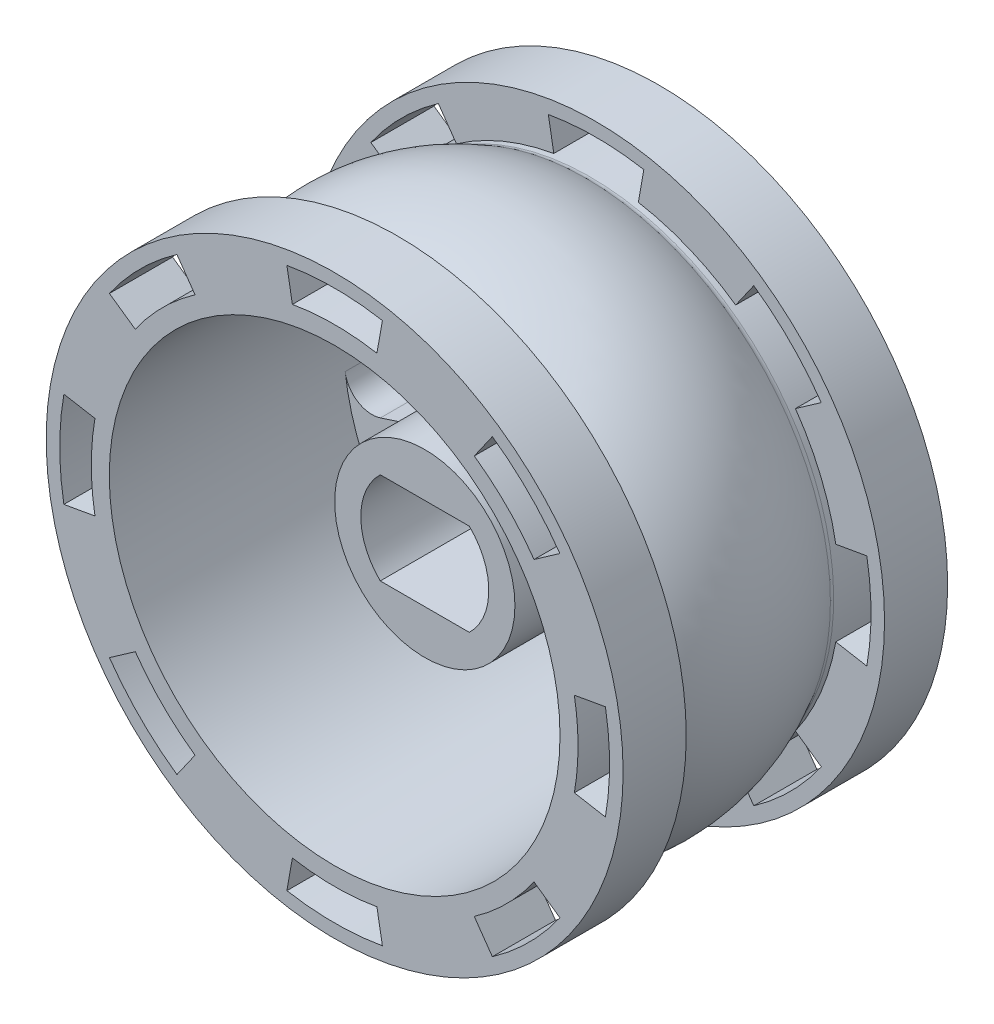
from build123d import *
from build123d.topology import SkipClean

# Parameters (mm, degrees)
SKETCH_1_R                      = 16
EXTRUDE_1_DEPTH                 = 9
SKETCH_2_R                      = 12.5
CUT_EXTRUDE_1_DEPTH             = 13
CUT_EXTRUDE_2_DEPTH             = 10
PATTERN_CIRCULAR_1_COUNT        = 3
EXTRUDE_START                   = 8
SKETCH_4_R                      = 5
EXTRUDE_2_DEPTH                 = 8
CUT_EXTRUDE_3_DEPTH             = 16
SKETCH_6_R                      = 1.275
CUT_EXTRUDE_4_DEPTH             = 10
PATTERN_CIRCULAR_2_COUNT        = 3
SKETCH_7_R                      = 20
SKETCH_7_R_2                    = 13.5
CUT_EXTRUDE_5_DEPTH             = 5.5
CUT_EXTRUDE_START               = -5
CUT_EXTRUDE_6_DEPTH             = 5
PATTERN_CIRCULAR_3_COUNT        = 8
PATTERN_START                   = -5
PATTERN_CIRCULAR_3_COPY_1_DEPTH = 5
PATTERN_CIRCULAR_3_COPY_2_DEPTH = 5
PATTERN_CIRCULAR_3_COPY_3_DEPTH = 5
PATTERN_CIRCULAR_3_COPY_4_DEPTH = 5
PATTERN_CIRCULAR_3_COPY_5_DEPTH = 5
PATTERN_CIRCULAR_3_COPY_6_DEPTH = 5
PATTERN_CIRCULAR_3_COPY_7_DEPTH = 5
FILLET_1_R                      = 1.5
FILLET_2_R                      = 0.5


with BuildPart() as part:
    # 草图1 → 凸台-拉伸1 (new, symmetric)
    with BuildSketch(Plane.XY):
        Circle(SKETCH_1_R)
    extrude(amount=EXTRUDE_1_DEPTH, both=True)

    # 草图2 → 切除-拉伸1 (cut)
    with BuildSketch(Plane.XY.offset(9)):
        Circle(SKETCH_2_R)
    extrude(amount=-CUT_EXTRUDE_1_DEPTH, mode=Mode.SUBTRACT)

    # 草图3 → 切除-拉伸2 (cut)
    with BuildSketch(Plane.XY.offset(-4)):
        with BuildLine():
            ThreePointArc((3.25, -3.799671038), (1.732288199, -4.69032809), (0, -5))
            Line((0, -5), (0, -12.5))
            ThreePointArc((0, -12.5), (4.785933382, -11.547503698), (8.842493348, -8.835174667))
            Line((8.842493348, -8.835174667), (3.25, -3.799671038))
        make_face()
        with BuildLine():
            ThreePointArc((0, -5), (-1.732288199, -4.69032809), (-3.25, -3.799671038))
            Line((-3.25, -3.799671038), (-8.842493348, -8.835174667))
            ThreePointArc((-8.842493348, -8.835174667), (-4.785933382, -11.547503698), (0, -12.5))
            Line((0, -12.5), (0, -5))
        make_face()
    cut_extrude_2 = extrude(amount=-CUT_EXTRUDE_2_DEPTH, mode=Mode.SUBTRACT)

    # 阵列(圆周)1: 切除-拉伸2 ×3 about axis
    pattern_circular_1_axis = Axis((0, 0, 0), (0, 0, 1))
    for i in range(1, PATTERN_CIRCULAR_1_COUNT):
        add(cut_extrude_2.rotate(pattern_circular_1_axis, i * 360 / PATTERN_CIRCULAR_1_COUNT), mode=Mode.SUBTRACT)

    # 草图4 → 凸台-拉伸2 (add)
    with BuildSketch(Plane.XY.offset(-4).offset(EXTRUDE_START)):
        Circle(SKETCH_4_R)
    extrude(amount=-EXTRUDE_2_DEPTH)

    # 草图5 → 切除-拉伸3 (cut)
    with BuildSketch(Plane.XY.offset(4)):
        with BuildLine():
            Line((2.469817807, 2.55), (-2.469817807, 2.55))
            ThreePointArc((-2.469817807, 2.55), (-3.55, 0), (-2.469817807, -2.55))
            Line((-2.469817807, -2.55), (2.469817807, -2.55))
            ThreePointArc((2.469817807, -2.55), (3.26881884, -1.384674472), (3.55, 0))
            ThreePointArc((3.55, 0), (3.26881884, 1.384674472), (2.469817807, 2.55))
        make_face()
    extrude(amount=-CUT_EXTRUDE_3_DEPTH, mode=Mode.SUBTRACT)

    # 草图6 → 切除-拉伸4 (cut)
    with BuildSketch(Plane(origin=(0, 0, -9), x_dir=(-1, 0, 0), z_dir=(0, 0, -1))):
        with Locations((0, 10)):
            Circle(SKETCH_6_R)
    cut_extrude_4 = extrude(amount=-CUT_EXTRUDE_4_DEPTH, mode=Mode.SUBTRACT)

    # 阵列(圆周)2: 切除-拉伸4 ×3 about axis
    pattern_circular_2_axis = Axis((0, 0, 0), (0, 0, 1))
    for i in range(1, PATTERN_CIRCULAR_2_COUNT):
        add(cut_extrude_4.rotate(pattern_circular_2_axis, i * 360 / PATTERN_CIRCULAR_2_COUNT), mode=Mode.SUBTRACT)

    # 草图7 → 切除-拉伸5 (cut, symmetric)
    with BuildSketch(Plane.XY):
        Circle(SKETCH_7_R)
        Circle(SKETCH_7_R_2, mode=Mode.SUBTRACT)
    extrude(amount=CUT_EXTRUDE_5_DEPTH, both=True, mode=Mode.SUBTRACT)

    # 草图8 → 切除-拉伸6 (cut)
    with SkipClean():  # the faces are left unmerged after this step: merging them gives an invalid solid
        with BuildSketch(Plane.XY.offset(-5.5).offset(CUT_EXTRUDE_START)):
            with BuildLine():
                Line((-2.648134709, 15.018318233), (-2.344250399, 13.294904666))
                ThreePointArc((-2.344250399, 13.294904666), (-1.176602527, 13.448628424), (0, 13.5))
                Line((0, 13.5), (0, 15.25))
                ThreePointArc((0, 15.25), (-1.329125077, 15.191969146), (-2.648134709, 15.018318233))
            make_face()
            with BuildLine():
                Line((0, 15.25), (0, 13.5))
                ThreePointArc((0, 13.5), (1.176602527, 13.448628424), (2.344250399, 13.294904666))
                Line((2.344250399, 13.294904666), (2.648134709, 15.018318233))
                ThreePointArc((2.648134709, 15.018318233), (1.329125077, 15.191969146), (0, 15.25))
            make_face()
        cut_extrude_6 = extrude(amount=CUT_EXTRUDE_6_DEPTH, mode=Mode.SUBTRACT)

    # 镜向1: 切除-拉伸6 across plane
    with SkipClean():  # the faces are left unmerged after this step: merging them gives an invalid solid
        add(cut_extrude_6.mirror(Plane.XY), mode=Mode.SUBTRACT)

    # 阵列(圆周)3: 切除-拉伸6 ×8 about axis
    with SkipClean():  # the faces are left unmerged after this step: merging them gives an invalid solid
        pattern_circular_3_axis = Axis((0, 0, 0), (0, 0, 1))
        for i in range(1, PATTERN_CIRCULAR_3_COUNT):
            add(cut_extrude_6.rotate(pattern_circular_3_axis, i * 360 / PATTERN_CIRCULAR_3_COUNT), mode=Mode.SUBTRACT)

    # 阵列(圆周)3 copy 1 sketch → 阵列(圆周)3 copy 1 (cut)
    with SkipClean():  # the faces are left unmerged after this step: merging them gives an invalid solid
        with BuildSketch(Plane(origin=(0, 0, 5.5), x_dir=(0.7071067811865476, 0.7071067811865475, 0), z_dir=(0, 0, -1)).offset(PATTERN_START)):
            with BuildLine():
                Line((-2.648134709, -15.018318233), (-2.344250399, -13.294904666))
                ThreePointArc((-2.344250399, -13.294904666), (-1.176602527, -13.448628424), (0, -13.5))
                Line((0, -13.5), (0, -15.25))
                ThreePointArc((0, -15.25), (-1.329125077, -15.191969146), (-2.648134709, -15.018318233))
            make_face()
            with BuildLine():
                Line((0, -15.25), (0, -13.5))
                ThreePointArc((0, -13.5), (1.176602527, -13.448628424), (2.344250399, -13.294904666))
                Line((2.344250399, -13.294904666), (2.648134709, -15.018318233))
                ThreePointArc((2.648134709, -15.018318233), (1.329125077, -15.191969146), (0, -15.25))
            make_face()
        extrude(amount=PATTERN_CIRCULAR_3_COPY_1_DEPTH, mode=Mode.SUBTRACT)

    # 阵列(圆周)3 copy 2 sketch → 阵列(圆周)3 copy 2 (cut)
    with SkipClean():  # the faces are left unmerged after this step: merging them gives an invalid solid
        with BuildSketch(Plane.YX.offset(-5.5).offset(PATTERN_START)):
            with BuildLine():
                Line((-2.648134709, -15.018318233), (-2.344250399, -13.294904666))
                ThreePointArc((-2.344250399, -13.294904666), (-1.176602527, -13.448628424), (0, -13.5))
                Line((0, -13.5), (0, -15.25))
                ThreePointArc((0, -15.25), (-1.329125077, -15.191969146), (-2.648134709, -15.018318233))
            make_face()
            with BuildLine():
                Line((0, -15.25), (0, -13.5))
                ThreePointArc((0, -13.5), (1.176602527, -13.448628424), (2.344250399, -13.294904666))
                Line((2.344250399, -13.294904666), (2.648134709, -15.018318233))
                ThreePointArc((2.648134709, -15.018318233), (1.329125077, -15.191969146), (0, -15.25))
            make_face()
        extrude(amount=PATTERN_CIRCULAR_3_COPY_2_DEPTH, mode=Mode.SUBTRACT)

    # 阵列(圆周)3 copy 3 sketch → 阵列(圆周)3 copy 3 (cut)
    with SkipClean():  # the faces are left unmerged after this step: merging them gives an invalid solid
        with BuildSketch(Plane(origin=(0, 0, 5.5), x_dir=(-0.7071067811865475, 0.7071067811865476, 0), z_dir=(0, 0, -1)).offset(PATTERN_START)):
            with BuildLine():
                Line((-2.648134709, -15.018318233), (-2.344250399, -13.294904666))
                ThreePointArc((-2.344250399, -13.294904666), (-1.176602527, -13.448628424), (0, -13.5))
                Line((0, -13.5), (0, -15.25))
                ThreePointArc((0, -15.25), (-1.329125077, -15.191969146), (-2.648134709, -15.018318233))
            make_face()
            with BuildLine():
                Line((0, -15.25), (0, -13.5))
                ThreePointArc((0, -13.5), (1.176602527, -13.448628424), (2.344250399, -13.294904666))
                Line((2.344250399, -13.294904666), (2.648134709, -15.018318233))
                ThreePointArc((2.648134709, -15.018318233), (1.329125077, -15.191969146), (0, -15.25))
            make_face()
        extrude(amount=PATTERN_CIRCULAR_3_COPY_3_DEPTH, mode=Mode.SUBTRACT)

    # 阵列(圆周)3 copy 4 sketch → 阵列(圆周)3 copy 4 (cut)
    with SkipClean():  # the faces are left unmerged after this step: merging them gives an invalid solid
        with BuildSketch(Plane(origin=(0, 0, 5.5), x_dir=(-1, 0, 0), z_dir=(0, 0, -1)).offset(PATTERN_START)):
            with BuildLine():
                Line((-2.648134709, -15.018318233), (-2.344250399, -13.294904666))
                ThreePointArc((-2.344250399, -13.294904666), (-1.176602527, -13.448628424), (0, -13.5))
                Line((0, -13.5), (0, -15.25))
                ThreePointArc((0, -15.25), (-1.329125077, -15.191969146), (-2.648134709, -15.018318233))
            make_face()
            with BuildLine():
                Line((0, -15.25), (0, -13.5))
                ThreePointArc((0, -13.5), (1.176602527, -13.448628424), (2.344250399, -13.294904666))
                Line((2.344250399, -13.294904666), (2.648134709, -15.018318233))
                ThreePointArc((2.648134709, -15.018318233), (1.329125077, -15.191969146), (0, -15.25))
            make_face()
        extrude(amount=PATTERN_CIRCULAR_3_COPY_4_DEPTH, mode=Mode.SUBTRACT)

    # 阵列(圆周)3 copy 5 sketch → 阵列(圆周)3 copy 5 (cut)
    with SkipClean():  # the faces are left unmerged after this step: merging them gives an invalid solid
        with BuildSketch(Plane(origin=(0, 0, 5.5), x_dir=(-0.7071067811865477, -0.7071067811865475, 0), z_dir=(0, 0, -1)).offset(PATTERN_START)):
            with BuildLine():
                Line((-2.648134709, -15.018318233), (-2.344250399, -13.294904666))
                ThreePointArc((-2.344250399, -13.294904666), (-1.176602527, -13.448628424), (0, -13.5))
                Line((0, -13.5), (0, -15.25))
                ThreePointArc((0, -15.25), (-1.329125077, -15.191969146), (-2.648134709, -15.018318233))
            make_face()
            with BuildLine():
                Line((0, -15.25), (0, -13.5))
                ThreePointArc((0, -13.5), (1.176602527, -13.448628424), (2.344250399, -13.294904666))
                Line((2.344250399, -13.294904666), (2.648134709, -15.018318233))
                ThreePointArc((2.648134709, -15.018318233), (1.329125077, -15.191969146), (0, -15.25))
            make_face()
        extrude(amount=PATTERN_CIRCULAR_3_COPY_5_DEPTH, mode=Mode.SUBTRACT)

    # 阵列(圆周)3 copy 6 sketch → 阵列(圆周)3 copy 6 (cut)
    with SkipClean():  # the faces are left unmerged after this step: merging them gives an invalid solid
        with BuildSketch(Plane(origin=(0, 0, 5.5), x_dir=(0, -1, 0), z_dir=(0, 0, -1)).offset(PATTERN_START)):
            with BuildLine():
                Line((-2.648134709, -15.018318233), (-2.344250399, -13.294904666))
                ThreePointArc((-2.344250399, -13.294904666), (-1.176602527, -13.448628424), (0, -13.5))
                Line((0, -13.5), (0, -15.25))
                ThreePointArc((0, -15.25), (-1.329125077, -15.191969146), (-2.648134709, -15.018318233))
            make_face()
            with BuildLine():
                Line((0, -15.25), (0, -13.5))
                ThreePointArc((0, -13.5), (1.176602527, -13.448628424), (2.344250399, -13.294904666))
                Line((2.344250399, -13.294904666), (2.648134709, -15.018318233))
                ThreePointArc((2.648134709, -15.018318233), (1.329125077, -15.191969146), (0, -15.25))
            make_face()
        extrude(amount=PATTERN_CIRCULAR_3_COPY_6_DEPTH, mode=Mode.SUBTRACT)

    # 阵列(圆周)3 copy 7 sketch → 阵列(圆周)3 copy 7 (cut)
    with SkipClean():  # the faces are left unmerged after this step: merging them gives an invalid solid
        with BuildSketch(Plane(origin=(0, 0, 5.5), x_dir=(0.7071067811865474, -0.7071067811865477, 0), z_dir=(0, 0, -1)).offset(PATTERN_START)):
            with BuildLine():
                Line((-2.648134709, -15.018318233), (-2.344250399, -13.294904666))
                ThreePointArc((-2.344250399, -13.294904666), (-1.176602527, -13.448628424), (0, -13.5))
                Line((0, -13.5), (0, -15.25))
                ThreePointArc((0, -15.25), (-1.329125077, -15.191969146), (-2.648134709, -15.018318233))
            make_face()
            with BuildLine():
                Line((0, -15.25), (0, -13.5))
                ThreePointArc((0, -13.5), (1.176602527, -13.448628424), (2.344250399, -13.294904666))
                Line((2.344250399, -13.294904666), (2.648134709, -15.018318233))
                ThreePointArc((2.648134709, -15.018318233), (1.329125077, -15.191969146), (0, -15.25))
            make_face()
        extrude(amount=PATTERN_CIRCULAR_3_COPY_7_DEPTH, mode=Mode.SUBTRACT)

    # 圆角1
    # the kernel refuses this fillet: 1.5 mm, written as the material it adds along each edge
    with BuildSketch(Plane(origin=(-3.25, -3.799671038, -4), x_dir=(-0.743144825477395, -0.6691306063588571, 0), z_dir=(0, 0, -1)), Plane(origin=(4.915611645, -0.914747043, -4), x_dir=(0.9510565162951531, -0.309016994374949, 0), z_dir=(0, 0, -1)), Plane(origin=(-1.665611645, 4.714418081, -4), x_dir=(-0.20791169081775754, 0.978147600733806, 0), z_dir=(0, 0, -1))) as fillet_1_piece_1:
        with BuildLine():
            CenterArc((1.176768393, -1.5), FILLET_1_R, 90, 70.693575646)
            ThreePointArc((-0.238877437, -1.004069677), (-0.093461995, -0.508214941), (0, 0))
            Line((0, 0), (1.176768393, 0))
        make_face()
    extrude(amount=5)
    with BuildSketch(Plane(origin=(3.25, -3.799671038, -4), x_dir=(0.7431448254773962, -0.669130606358856, 0), z_dir=(0, 0, -1)), Plane(origin=(1.665611645, 4.714418081, -4), x_dir=(0.20791169081775596, 0.9781476007338065, 0), z_dir=(0, 0, -1)), Plane(origin=(-4.915611645, -0.914747043, -4), x_dir=(-0.9510565162951528, -0.30901699437495, 0), z_dir=(0, 0, -1))) as fillet_1_piece_2:
        with BuildLine():
            CenterArc((1.176768393, 1.5), FILLET_1_R, 199.306424354, 70.693575646)
            ThreePointArc((-0.238877437, 1.004069677), (-0.093461995, 0.508214941), (0, 0))
            Line((0, 0), (1.176768393, 0))
        make_face()
    extrude(amount=5)
    with BuildSketch(Plane(origin=(8.842493348, -8.835174667, -4), x_dir=(-0.7560957516083731, -0.6544610106032058, 0), z_dir=(0, 0, -1)), Plane(origin=(3.230239034, 12.075411206, -4), x_dir=(0.9448277367730099, -0.32756762328470734, 0), z_dir=(0, 0, -1)), Plane(origin=(-12.072732382, -3.240236539, -4), x_dir=(-0.1887319851646478, 0.9820286338879387, 0), z_dir=(0, 0, -1))) as fillet_1_piece_3:
        with BuildLine():
            CenterArc((1.698569308, 1.49607662), FILLET_1_R, 172.878793551, 101.266133761)
            Line((0.210140125, 1.682029748), (0, 0))
            ThreePointArc((0, 0), (0.903494313, -0.032694837), (1.806988626, 0))
        make_face()
    extrude(amount=5)
    with BuildSketch(Plane(origin=(-8.842493348, -8.835174667, -4), x_dir=(0.7560957516083688, -0.6544610106032106, 0), z_dir=(0, 0, -1)), Plane(origin=(12.072732382, -3.240236539, -4), x_dir=(0.1887319851646363, 0.9820286338879408, 0), z_dir=(0, 0, -1)), Plane(origin=(-3.230239034, 12.075411206, -4), x_dir=(-0.9448277367730111, -0.3275676232847037, 0), z_dir=(0, 0, -1))) as fillet_1_piece_4:
        with BuildLine():
            CenterArc((1.698569308, -1.49607662), FILLET_1_R, 85.855072688, 101.266133761)
            Line((0.210140125, -1.682029748), (0, 0))
            ThreePointArc((0, 0), (0.903494313, 0.032694837), (1.806988626, 0))
        make_face()
    extrude(amount=5)

    # 草图9 → 旋转1 (revolve)
    with BuildSketch(Plane(origin=(0, 0, 0), x_dir=(1, 0, 0), z_dir=(0, 1, 0)), mode=Mode.PRIVATE) as revolve_1_sk:
        with BuildLine():
            Line((-13.3, -5.372761271), (-13.3, 5.372761271))
            ThreePointArc((-13.3, 5.372761271), (-14.865935954, 0), (-13.3, -5.372761271))
        make_face()
    revolve(revolve_1_sk.sketch.rotate(Axis((0, 0, 0), (0, 0, -1)), 180), axis=Axis((0, 0, 0), (0, 0, -1)))

    # 圆角2
    fillet_2_edges = [part.edges().sort_by_distance(p)[0] for p in [
        (-13.499999998, -1e-09, -5.04509049),
        (-13.499999999, -2e-09, 5.04509049),
    ]]
    fillet(fillet_2_edges, radius=FILLET_2_R)


solid = part.part
